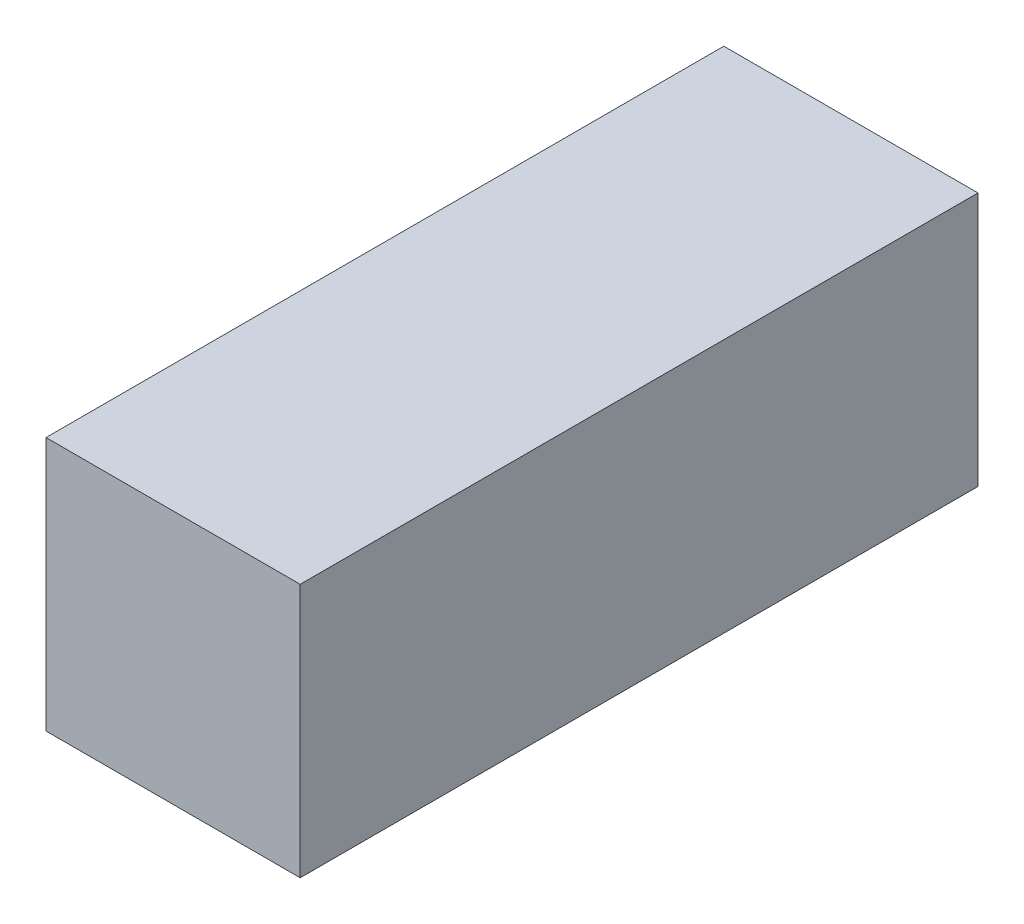
from build123d import *

# Parameters (mm, degrees)
SKETCH1_W           = 38.1
SKETCH1_H           = 38.1
BOSS_EXTRUDE1_DEPTH = 101.6


with BuildPart() as part:
    # Sketch1 → Boss-Extrude1 (new body)
    with BuildSketch(Plane.XY):
        with Locations((10.31875, 12.79921875)):
            Rectangle(SKETCH1_W, SKETCH1_H)
    extrude(amount=BOSS_EXTRUDE1_DEPTH)


solid = part.part
